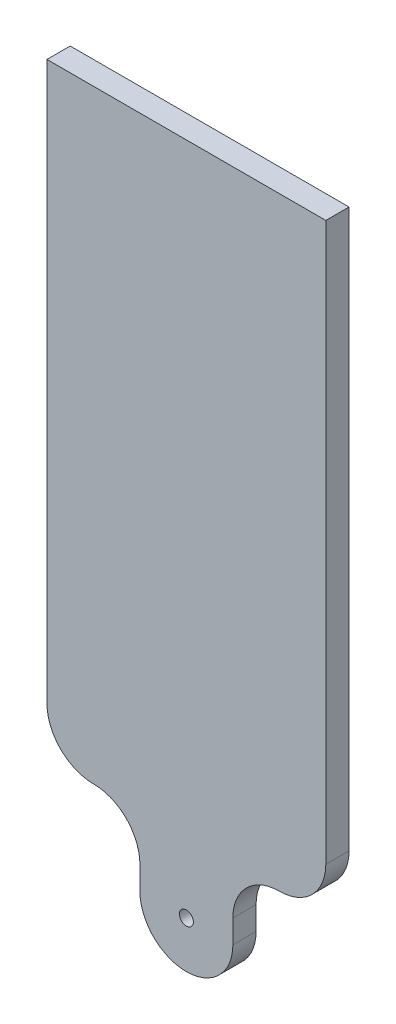
from build123d import *

# Parameters (mm, degrees)
RESSALTO_EXTRUS_O1_DEPTH = 5
ESBO_O2_R                = 1.5
CORTE_EXTRUS_O1_DEPTH    = 5
FILETE1_R                = 10


with BuildPart() as part:
    # Esboço1 → Ressalto-extrusão1 (new body)
    with BuildSketch(Plane.XY):
        with BuildLine():
            Line((-14.089663978, 13.135393664), (-14.089663978, 28.135393664))
            Line((-14.089663978, 28.135393664), (-34.089663978, 28.135393664))
            Line((-34.089663978, 28.135393664), (-34.089663978, 158.135393664))
            Line((-34.089663978, 158.135393664), (25.910336022, 158.135393664))
            Line((25.910336022, 158.135393664), (25.910336022, 28.135393664))
            Line((25.910336022, 28.135393664), (5.910336022, 28.135393664))
            Line((5.910336022, 28.135393664), (5.910336022, 13.135393664))
            ThreePointArc((5.910336022, 13.135393664), (-4.089663978, 3.135393664), (-14.089663978, 13.135393664))
        make_face()
    extrude(amount=RESSALTO_EXTRUS_O1_DEPTH)

    # Esboço2 → Corte-extrusão1 (cut)
    with BuildSketch(Plane.XY.offset(5)):
        with Locations((-4.089663978, 13.135393664)):
            Circle(ESBO_O2_R)
    extrude(amount=-CORTE_EXTRUS_O1_DEPTH, mode=Mode.SUBTRACT)

    # Filete1
    filete1_edges = [part.edges().sort_by_distance(p)[0] for p in [
        (-14.089663978, 28.135393664, 2.5),
    ]]
    fillet(filete1_edges, radius=FILETE1_R)
    filete1_2_edges = [part.edges().sort_by_distance(p)[0] for p in [
        (-34.089663978, 28.135393664, 2.5),
    ]]
    fillet(filete1_2_edges, radius=FILETE1_R - 0.0001)  # a hair under: the kernel refuses the full size
    filete1_3_edges = [part.edges().sort_by_distance(p)[0] for p in [
        (5.910336022, 28.135393664, 2.5),
    ]]
    fillet(filete1_3_edges, radius=FILETE1_R)
    filete1_4_edges = [part.edges().sort_by_distance(p)[0] for p in [
        (25.910336022, 28.135393664, 2.5),
    ]]
    fillet(filete1_4_edges, radius=FILETE1_R - 0.0001)  # a hair under: the kernel refuses the full size


solid = part.part
